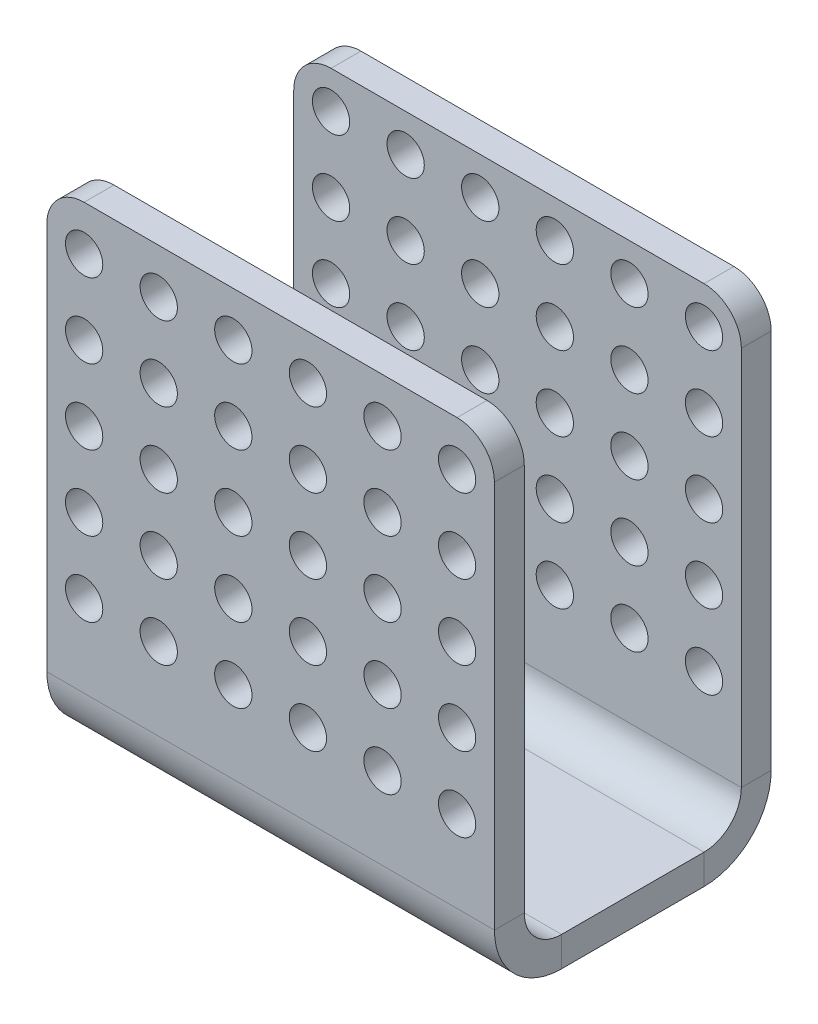
from build123d import *

# Parameters (mm, degrees)
SKETCH2_W                    = 60
SKETCH2_H                    = 29.1
BASE_FLANGE1_DEPTH           = 4
EDGE_FLANGE1_STRIP_W         = 26
EDGE_FLANGE1_STRIP_H         = 4
EDGE_FLANGE1_STRIP_CUT_DEPTH = 60
EDGE_FLANGE1_DEPTH           = 60
EDGE_FLANGE2_STRIP_W         = 26
EDGE_FLANGE2_STRIP_H         = 4
EDGE_FLANGE2_STRIP_CUT_DEPTH = 60
EDGE_FLANGE2_DEPTH           = 60
F_1_0MM_DOWEL_HOLE1_D        = 5
LPATTERN1_COUNT              = 6
LPATTERN1_PITCH              = 10
LPATTERN1_COUNT_DIR2         = 5
LPATTERN1_PITCH_DIR2         = 10
FILLET1_R                    = 5


# Sheet-metal steps are written as plain solids
with BuildPart() as part:
    # Sketch2 → Base-Flange1 (new body)
    with BuildSketch(Plane(origin=(0, 0, 0), x_dir=(1, 0, 0), z_dir=(0, 1, 0))):
        Rectangle(SKETCH2_W, SKETCH2_H)
    extrude(amount=-BASE_FLANGE1_DEPTH)

    # Edge-Flange1 strip (across the edge) → Edge-Flange1 strip cut (cut)
    with BuildSketch(Plane(origin=(-30, 0, 14.55), x_dir=(0, 0, -1), z_dir=(1, 0, 0))):
        with Locations((-8, -2)):
            Rectangle(EDGE_FLANGE1_STRIP_W, EDGE_FLANGE1_STRIP_H)
    extrude(amount=EDGE_FLANGE1_STRIP_CUT_DEPTH, mode=Mode.SUBTRACT)

    # Edge-Flange1 section (across the edge) → Edge-Flange1 (add)
    with BuildSketch(Plane(origin=(-30, 0, 14.55), x_dir=(0, 0, -1), z_dir=(1, 0, 0))):
        with BuildLine():
            Line((-4, 5), (-4, 62))
            Line((-4, 62), (0, 62))
            Line((0, 62), (0, 5))
            ThreePointArc((0, 5), (1.464466094, 1.464466094), (5, 0))
            Line((5, 0), (5, -4))
            ThreePointArc((5, -4), (-1.363961031, -1.363961031), (-4, 5))
        make_face()
    extrude(amount=EDGE_FLANGE1_DEPTH)

    # Edge-Flange2 strip (across the edge) → Edge-Flange2 strip cut (cut)
    with BuildSketch(Plane(origin=(30, 0, -14.55), x_dir=(0, 0, 1), z_dir=(-1, 0, 0))):
        with Locations((-8, -2)):
            Rectangle(EDGE_FLANGE2_STRIP_W, EDGE_FLANGE2_STRIP_H)
    extrude(amount=EDGE_FLANGE2_STRIP_CUT_DEPTH, mode=Mode.SUBTRACT)

    # Edge-Flange2 section (across the edge) → Edge-Flange2 (add)
    with BuildSketch(Plane(origin=(30, 0, -14.55), x_dir=(0, 0, 1), z_dir=(-1, 0, 0))):
        with BuildLine():
            Line((-4, 5), (-4, 61))
            Line((-4, 61), (0, 61))
            Line((0, 61), (0, 5))
            ThreePointArc((0, 5), (1.464466094, 1.464466094), (5, 0))
            Line((5, 0), (5, -4))
            ThreePointArc((5, -4), (-1.363961031, -1.363961031), (-4, 5))
        make_face()
    extrude(amount=EDGE_FLANGE2_DEPTH)

    # Ø1.0mm Dowel Hole1 (through all)
    with Locations(Plane(origin=(0, 0, -18.55), x_dir=(-1, 0, 0), z_dir=(0, 0, -1))):
        with Locations((-25, 56)):
            f_1_0mm_dowel_hole1 = Hole(F_1_0MM_DOWEL_HOLE1_D / 2)

    # LPattern1: 1.0mm Dowel Hole1 6 × 5
    with Locations(*[(-i * LPATTERN1_PITCH, -j * LPATTERN1_PITCH_DIR2, 0) for i in range(LPATTERN1_COUNT) for j in range(LPATTERN1_COUNT_DIR2) if (i, j) != (0, 0)]):
        add(f_1_0mm_dowel_hole1, mode=Mode.SUBTRACT)

    # Fillet1
    fillet1_edges = [part.edges().sort_by_distance(p)[0] for p in [
        (-30, 62, 16.55),
        (30, 62, 16.55),
        (30, 61, -16.55),
        (-30, 61, -16.55),
    ]]
    fillet(fillet1_edges, radius=FILLET1_R)


solid = part.part
